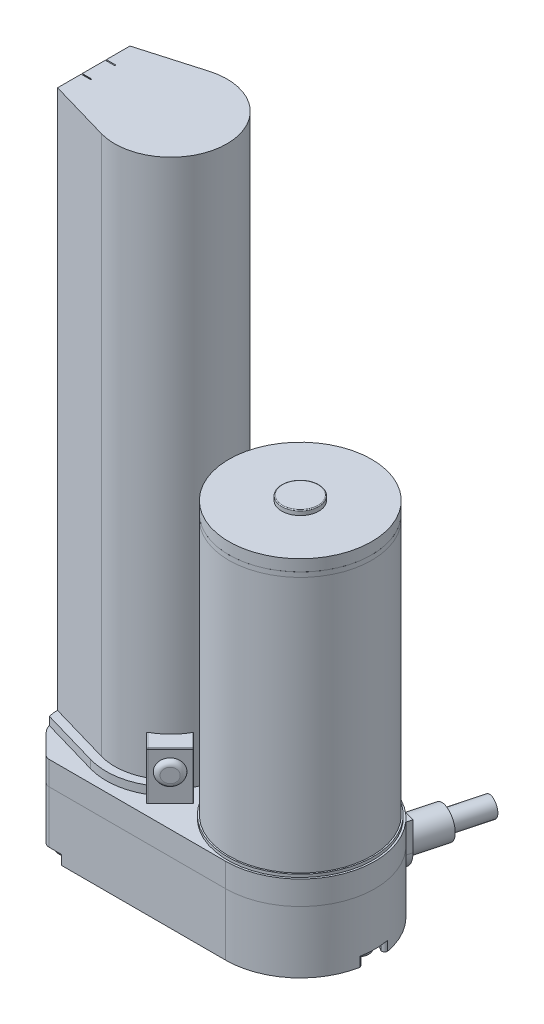
from build123d import *

# Parameters (mm, degrees)
BOSS_EXTRUDE1_DEPTH      = 6.35
SKETCH6_R                = 19.431
BOSS_EXTRUDE4_DEPTH      = 0.762
SKETCH7_R                = 19.05
BOSS_EXTRUDE5_DEPTH      = 68.326
FILLET6_R                = 5.08
FILLET7_R                = 1.905
BOSS_EXTRUDE15_DEPTH     = 6.35
SKETCH24_R               = 4.064
BOSS_EXTRUDE16_DEPTH     = 10.16
SKETCH25_R               = 2.54
BOSS_EXTRUDE17_DEPTH     = 10.16
BOSS_EXTRUDE19_DEPTH     = 16.51
FILLET13_R               = 1.905
FILLET14_R               = 5.08
BOSS_EXTRUDE20_DEPTH     = 18.796
CHAMFER1_SIZE            = 2.54
FILLET15_R               = 2.54
CHAMFER2_SIZE            = 0.762
SKETCH27_R               = 3.175
CUT_EXTRUDE3_DEPTH       = 19.05
SKETCH28_R               = 19.05
BOSS_EXTRUDE22_DEPTH     = 1.27
SKETCH29_R               = 19.05
BOSS_EXTRUDE24_DEPTH     = 3.048
BOSS_EXTRUDE25_START     = 4.318
SKETCH8_R                = 4.953
BOSS_EXTRUDE25_DEPTH     = 1.27
FILLET16_R               = 0.2286
BOSS_EXTRUDE26_DEPTH     = 152.781
BOSS_EXTRUDE27_DEPTH     = 8.89
SKETCH33_R               = 9.906
BOSS_EXTRUDE28_DEPTH     = 21.336
BOSS_EXTRUDE30_DEPTH     = 2.159
BOSS_EXTRUDE31_DEPTH     = 2.159
BOSS_EXTRUDE33_DEPTH     = 12.7
BOSS_EXTRUDE33_2_DEPTH   = 12.7
FILLET17_R               = 0.2286
FILLET18_R               = 0.2286
SKETCH43_R               = 3.175
BOSS_EXTRUDE34_DEPTH     = 1.27
FILLET19_R               = 1.27
SKETCH44_R               = 3.175
BOSS_EXTRUDE35_DEPTH     = 1.27
FILLET20_R               = 1.27
CUT_EXTRUDE5_START       = -2.54
CUT_EXTRUDE5_DEPTH       = 2.54
CUT_EXTRUDE6_START       = -2.54
CUT_EXTRUDE6_DEPTH       = 2.54
SKETCH47_R               = 2.54
BOSS_EXTRUDE36_DEPTH     = 2.54
BOSS_EXTRUDE36_2_DEPTH   = 2.54
BOSS_EXTRUDE36_3_DEPTH   = 2.54
FILLET22_R               = 1.524
FILLET23_R               = 1.524
SKETCH48_R               = 3.81
BOSS_EXTRUDE37_DEPTH     = 1.524
FILLET24_R               = 1.524
FILLET25_R               = 1.524
SKETCH49_R               = 3.81
CUT_EXTRUDE7_DEPTH       = 2.54
SKETCH50_R               = 3.556
BOSS_EXTRUDE39_DEPTH     = 2.54
CUT_EXTRUDE11_DEPTH      = 210.651074554
CUT_EXTRUDE11_DEPTH_BACK = 210.651074554
SKETCH52_R               = 3.175
SKETCH53_W               = 89.132477826
SKETCH53_H               = 21.730821801
CUT_EXTRUDE12_DEPTH      = 104.394
SKETCH54_W               = 24.892281138
SKETCH54_H               = 21.336
CUT_EXTRUDE13_DEPTH      = 104.394
SKETCH55_W               = 78.405339805
SKETCH55_H               = 17.293725945
CUT_EXTRUDE14_DEPTH      = 104.394


with BuildPart() as part:
    # Sketch1 → Boss-Extrude1 (new body)
    with BuildSketch(Plane(origin=(0, 0, 0), x_dir=(1, 0, 0), z_dir=(0, 1, 0))):
        with BuildLine():
            Line((0, 32.639), (7.239, 39.878))
            Line((7.239, 39.878), (55.118, 39.878))
            ThreePointArc((55.118, 39.878), (75.057, 19.939), (55.118, 0))
            Line((55.118, 0), (7.239, 0))
            Line((7.239, 0), (0, 7.239))
            Line((0, 7.239), (0, 32.639))
        make_face()
    extrude(amount=BOSS_EXTRUDE1_DEPTH)

    # Fillet6
    fillet6_edges = [part.edges().sort_by_distance(p)[0] for p in [
        (0, 3.175, -7.239),
        (0, 3.175, -32.639),
    ]]
    fillet(fillet6_edges, radius=FILLET6_R)

    # Fillet7
    fillet7_edges = [part.edges().sort_by_distance(p)[0] for p in [
        (7.239, 3.175, 0),
        (7.239, 3.175, -39.878),
    ]]
    fillet(fillet7_edges, radius=FILLET7_R)


with BuildPart() as body_2:
    # Sketch6 → Boss-Extrude4 (new body)
    with BuildSketch(Plane(origin=(0, 6.35, 0), x_dir=(1, 0, 0), z_dir=(0, 1, 0))):
        with Locations(Location((55.118, 19.939, 0), (0, 0, 90))):
            Circle(SKETCH6_R)
    extrude(amount=BOSS_EXTRUDE4_DEPTH)


with BuildPart() as body_3:
    # Sketch7 → Boss-Extrude5 (new body)
    with BuildSketch(Plane(origin=(0, 7.112, 0), x_dir=(1, 0, 0), z_dir=(0, 1, 0))):
        with Locations(Location((55.118, 19.939, 0), (0, 0, 270))):
            Circle(SKETCH7_R)
    extrude(amount=BOSS_EXTRUDE5_DEPTH)


with BuildPart() as body_4:
    # Sketch23 → Boss-Extrude15 (new body)
    with BuildSketch(Plane(origin=(12.522748088, 0, -46.735532116), x_dir=(0, -1, 0), z_dir=(0.25881904510252135, 0, -0.9659258262890681))):
        with BuildLine():
            Line((-2.032, -53.883866243), (5.588, -53.883866243))
            ThreePointArc((5.588, -53.883866243), (11.303, -48.168866243), (5.588, -42.453866243))
            Line((5.588, -42.453866243), (-2.032, -42.453866243))
            Line((-2.032, -42.453866243), (-2.032, -53.883866243))
        make_face()
    extrude(amount=BOSS_EXTRUDE15_DEPTH)

    # Sketch24 → Boss-Extrude16 (add)
    with BuildSketch(Plane(origin=(14.166249025, 0, -52.869161113), x_dir=(-0.9659258262890682, 0, -0.25881904510252135), z_dir=(0.2588190451025213, 0, -0.9659258262890681))):
        with Locations((-48.168866243, -5.588)):
            Circle(SKETCH24_R)
    extrude(amount=BOSS_EXTRUDE16_DEPTH)

    # Sketch25 → Boss-Extrude17 (add)
    with BuildSketch(Plane(origin=(16.795850523, 0, -62.682967508), x_dir=(-0.9659258262890681, 0, -0.25881904510252135), z_dir=(0.25881904510252135, 0, -0.9659258262890681))):
        with Locations((-48.168866243, -5.588)):
            Circle(SKETCH25_R)
    extrude(amount=BOSS_EXTRUDE17_DEPTH)


with BuildPart() as body_5:
    # Sketch1<3> → Boss-Extrude19 (new body)
    with BuildSketch(Plane(origin=(0, 0, 0), x_dir=(1, 0, 0), z_dir=(0, 1, 0))):
        with BuildLine():
            Line((0, 32.639), (7.239, 39.878))
            Line((7.239, 39.878), (55.118, 39.878))
            ThreePointArc((55.118, 39.878), (75.057, 19.939), (55.118, 0))
            Line((55.118, 0), (7.239, 0))
            Line((7.239, 0), (0, 7.239))
            Line((0, 7.239), (0, 32.639))
        make_face()
    extrude(amount=-BOSS_EXTRUDE19_DEPTH)

    # Fillet13
    fillet13_edges = [body_5.edges().sort_by_distance(p)[0] for p in [
        (7.239, -8.255, 0),
        (7.239, -8.255, -39.878),
    ]]
    fillet(fillet13_edges, radius=FILLET13_R)

    # Fillet14
    fillet14_edges = [body_5.edges().sort_by_distance(p)[0] for p in [
        (0, -8.255, -7.239),
        (0, -8.255, -32.639),
    ]]
    fillet(fillet14_edges, radius=FILLET14_R)

    # Sketch45 → Cut-Extrude5 (cut)
    with BuildSketch(Plane.XZ.offset(16.51).offset(CUT_EXTRUDE5_START)):
        with BuildLine():
            ThreePointArc((5.044290367, -35.978344089), (4.718699387, -36.549691761), (4.084467985, -36.723467985))
            Line((4.084467985, -36.723467985), (6.681038418, -39.320038418))
            ThreePointArc((6.681038418, -39.320038418), (7.299064898, -39.732990509), (8.028076836, -39.878))
            Line((8.028076836, -39.878), (11.393838428, -39.878))
            ThreePointArc((11.393838428, -39.878), (11.138454644, -39.419455597), (11.282110896, -38.914632134))
            ThreePointArc((11.282110896, -38.914632134), (10.476958507, -32.531164357), (5.044290367, -35.978344089))
        make_face()
        with BuildLine():
            ThreePointArc((11.282110896, -0.963367866), (11.138454644, -0.458544403), (11.393838428, 0))
            Line((11.393838428, 0), (8.028076836, 0))
            ThreePointArc((8.028076836, 0), (7.299064898, -0.145009491), (6.681038418, -0.557961582))
            Line((6.681038418, -0.557961582), (4.084467985, -3.154532015))
            ThreePointArc((4.084467985, -3.154532015), (4.718699387, -3.328308239), (5.044290367, -3.899655911))
            ThreePointArc((5.044290367, -3.899655911), (10.476958507, -7.346835643), (11.282110896, -0.963367866))
        make_face()
    extrude(amount=CUT_EXTRUDE5_DEPTH, mode=Mode.SUBTRACT)

    # Sketch45<3> → Cut-Extrude6 (cut)
    with BuildSketch(Plane.XZ.offset(16.51).offset(CUT_EXTRUDE6_START)):
        with BuildLine():
            Line((4.084467985, -36.723467985), (6.681038418, -39.320038418))
            ThreePointArc((6.681038418, -39.320038418), (7.299064898, -39.732990509), (8.028076836, -39.878))
            Line((8.028076836, -39.878), (11.393838428, -39.878))
            ThreePointArc((11.393838428, -39.878), (11.138454644, -39.419455597), (11.282110896, -38.914632134))
            ThreePointArc((11.282110896, -38.914632134), (10.476958507, -32.531164357), (5.044290367, -35.978344089))
            ThreePointArc((5.044290367, -35.978344089), (4.718699387, -36.549691761), (4.084467985, -36.723467985))
        make_face()
        with BuildLine():
            Line((11.393838428, 0), (8.028076836, 0))
            ThreePointArc((8.028076836, 0), (7.299064898, -0.145009491), (6.681038418, -0.557961582))
            Line((6.681038418, -0.557961582), (4.084467985, -3.154532015))
            ThreePointArc((4.084467985, -3.154532015), (4.718699387, -3.328308239), (5.044290367, -3.899655911))
            ThreePointArc((5.044290367, -3.899655911), (10.476958507, -7.346835643), (11.282110896, -0.963367866))
            ThreePointArc((11.282110896, -0.963367866), (11.138454644, -0.458544403), (11.393838428, 0))
        make_face()
        with BuildLine():
            ThreePointArc((73.662109712, -16.992248385), (67.437, -19.939), (73.662109712, -22.885751615))
            ThreePointArc((73.662109712, -22.885751615), (74.341584064, -23.041280193), (74.712069674, -23.631716426))
            ThreePointArc((74.712069674, -23.631716426), (75.057, -19.939), (74.712069674, -16.246283574))
            ThreePointArc((74.712069674, -16.246283574), (74.341584064, -16.836719807), (73.662109712, -16.992248385))
        make_face()
    extrude(amount=CUT_EXTRUDE6_DEPTH, mode=Mode.SUBTRACT)


with BuildPart() as body_6:
    # Sketch26 → Boss-Extrude20 (new body)
    with BuildSketch(Plane(origin=(0, -16.51, 0), x_dir=(-1, 0, 0), z_dir=(0, -1, 0))):
        Polygon((-20.574, 28.829), (-11.684, 28.829), (-11.684, 11.049), (-29.464, 11.049), (-29.464, 28.829), align=None)
    extrude(amount=BOSS_EXTRUDE20_DEPTH)

    # Chamfer1
    chamfer1_edges = [body_6.edges().sort_by_distance(p)[0] for p in [
        (11.684, -25.908, -11.049),
        (29.464, -25.908, -11.049),
        (29.464, -25.908, -28.829),
        (11.684, -25.908, -28.829),
    ]]
    chamfer(chamfer1_edges, length=CHAMFER1_SIZE)

    # Fillet15
    fillet15_edges = [body_6.edges().sort_by_distance(p)[0] for p in [
        (29.464, -25.908, -13.589),
        (29.464, -25.908, -26.289),
        (14.224, -25.908, -28.829),
        (26.924, -25.908, -28.829),
        (14.224, -25.908, -11.049),
        (26.924, -25.908, -11.049),
        (11.684, -25.908, -26.289),
        (11.684, -25.908, -13.589),
    ]]
    fillet(fillet15_edges, radius=FILLET15_R)

    # Chamfer2
    chamfer2_edges = [body_6.edges().sort_by_distance(p)[0] for p in [
        (11.684, -35.306, -19.939),
        (12.954, -35.306, -12.319),
        (20.574, -35.306, -28.829),
        (28.194, -35.306, -27.559),
        (29.464, -35.306, -19.939),
        (28.194, -35.306, -12.319),
        (20.574, -35.306, -11.049),
        (12.954, -35.306, -27.559),
        (14.30408653, -35.306, -28.635654013),
        (11.877345987, -35.306, -26.20891347),
        (26.84391347, -35.306, -28.635654013),
        (29.270654013, -35.306, -26.20891347),
        (29.270654013, -35.306, -13.66908653),
        (26.84391347, -35.306, -11.242345987),
        (14.30408653, -35.306, -11.242345987),
        (11.877345987, -35.306, -13.66908653),
    ]]
    chamfer(chamfer2_edges, length=CHAMFER2_SIZE)

    # Sketch27 → Cut-Extrude3 (cut)
    with BuildSketch(Plane.XY.offset(-11.049)):
        with Locations((20.574, -26.67)):
            Circle(SKETCH27_R)
    extrude(amount=-CUT_EXTRUDE3_DEPTH, mode=Mode.SUBTRACT)

    # Sketch53 → Cut-Extrude12 (cut)
    with BuildSketch(Plane.XY):
        with Locations((44.566238913, -27.375410901)):
            Rectangle(SKETCH53_W, SKETCH53_H)
    extrude(amount=-CUT_EXTRUDE12_DEPTH, mode=Mode.SUBTRACT)


with BuildPart() as body_7:
    # Sketch28 → Boss-Extrude22 (new body)
    with BuildSketch(Plane(origin=(0, 75.438, 0), x_dir=(1, 0, 0), z_dir=(0, 1, 0))):
        with Locations(Location((55.118, 19.939, 0), (0, 0, 270))):
            Circle(SKETCH28_R)
    extrude(amount=BOSS_EXTRUDE22_DEPTH)


with BuildPart() as body_8:
    # Sketch29 → Boss-Extrude24 (new body)
    with BuildSketch(Plane(origin=(0, 76.708, 0), x_dir=(1, 0, 0), z_dir=(0, 1, 0))):
        with Locations(Location((55.118, 19.939, 0), (0, 0, 90))):
            Circle(SKETCH29_R)
    extrude(amount=BOSS_EXTRUDE24_DEPTH)

    # Sketch8 → Boss-Extrude25 (add)
    with BuildSketch(Plane(origin=(0, 75.438, 0), x_dir=(1, 0, 0), z_dir=(0, 1, 0)).offset(BOSS_EXTRUDE25_START)):
        with Locations(Location((55.118, 19.939, 0), (0, 0, 270))):
            Circle(SKETCH8_R)
    extrude(amount=BOSS_EXTRUDE25_DEPTH)

    # Fillet16
    fillet16_edges = [body_8.edges().sort_by_distance(p)[0] for p in [
        (55.118, 81.026, -24.892),
    ]]
    fillet(fillet16_edges, radius=FILLET16_R)


with BuildPart() as body_9:
    # Sketch15 → Boss-Extrude26 (new body)
    with BuildSketch(Plane(origin=(0, 6.35, 0), x_dir=(1, 0, 0), z_dir=(0, 1, 0))):
        with BuildLine():
            Line((0, 19.939), (0, 10.286870396))
            Line((0, 10.286870396), (16.411980417, 5.54225678))
            ThreePointArc((16.411980417, 5.54225678), (35.560281138, 19.939054609), (16.411875495, 34.335712887))
            Line((16.411875495, 34.335712887), (0, 29.591))
            Line((0, 29.591), (0, 19.939))
        make_face()
    extrude(amount=BOSS_EXTRUDE26_DEPTH)

    # Sketch48 → Boss-Extrude37 (add)
    with BuildSketch(Plane.ZY):
        with Locations(Location((-19.939, 12.7, 0), (0, 0, 180))):
            Circle(SKETCH48_R)
    extrude(amount=BOSS_EXTRUDE37_DEPTH)

    # Fillet24
    fillet24_edges = [body_9.edges().sort_by_distance(p)[0] for p in [
        (-1.524, 12.7, -16.129),
    ]]
    fillet(fillet24_edges, radius=FILLET24_R - 0.0001)  # a hair under: the kernel refuses the full size

    # Sketch49 → Cut-Extrude7 (cut)
    with BuildSketch(Plane.ZY):
        with Locations((-19.938935198, 154.178)):
            Circle(SKETCH49_R)
    extrude(amount=-CUT_EXTRUDE7_DEPTH, mode=Mode.SUBTRACT)

    # Sketch50 → Boss-Extrude39 (add)
    with BuildSketch(Plane.ZY.offset(-2.54)):
        with Locations((-19.938935198, 154.178)):
            Circle(SKETCH50_R)
    extrude(amount=BOSS_EXTRUDE39_DEPTH)


with BuildPart() as body_10:
    # Sketch32 → Boss-Extrude27 (new body)
    with BuildSketch(Plane(origin=(0, 159.131, 0), x_dir=(1, 0, 0), z_dir=(0, 1, 0))):
        with BuildLine():
            Line((0, 10.286870396), (0, 29.591))
            Line((0, 29.591), (16.411875495, 34.335712887))
            ThreePointArc((16.411875495, 34.335712887), (35.560281138, 19.939054609), (16.411980417, 5.54225678))
            Line((16.411980417, 5.54225678), (0, 10.286870396))
        make_face()
    extrude(amount=BOSS_EXTRUDE27_DEPTH)

    # Sketch33 → Boss-Extrude28 (add)
    with BuildSketch(Plane(origin=(0, 168.021, 0), x_dir=(1, 0, 0), z_dir=(0, 1, 0))):
        with Locations(Location((20.574, 19.939, 0), (0, 0, 270))):
            Circle(SKETCH33_R)
    extrude(amount=BOSS_EXTRUDE28_DEPTH)

    # Sketch52 → Cut-Extrude11 (cut, two sides: drawn at the far end of the back side and taken through both)
    with BuildSketch(Plane.XY.offset(-11.049).offset(-CUT_EXTRUDE11_DEPTH_BACK)):
        with Locations(Location((20.574, 179.832, 0), (0, 0, 89.99999999))):
            Circle(SKETCH52_R)
    extrude(amount=CUT_EXTRUDE11_DEPTH + CUT_EXTRUDE11_DEPTH_BACK, mode=Mode.SUBTRACT)

    # Sketch54 → Cut-Extrude13 (cut)
    with BuildSketch(Plane.XY):
        with Locations((23.114140569, 178.689)):
            Rectangle(SKETCH54_W, SKETCH54_H)
    extrude(amount=-CUT_EXTRUDE13_DEPTH, mode=Mode.SUBTRACT)


with BuildPart() as body_11:
    # Sketch41 → Boss-Extrude30 (new body)
    with BuildSketch(Plane(origin=(0, 6.35, 0), x_dir=(1, 0, 0), z_dir=(0, 1, 0))):
        with BuildLine():
            Line((0, 29.591), (16.411875495, 34.335712887))
            ThreePointArc((16.411875495, 34.335712887), (22.021175201, 34.855243035), (27.425990452, 33.267122493))
            Line((27.425990452, 33.267122493), (29.11221422, 34.953346261))
            ThreePointArc((29.11221422, 34.953346261), (22.604273469, 37.091541659), (15.776987058, 36.531780434))
            Line((15.776987058, 36.531780434), (0.2736806, 32.049737053))
            Line((0.2736806, 32.049737053), (0, 30.534795103))
            Line((0, 30.534795103), (0, 29.591))
        make_face()
    extrude(amount=BOSS_EXTRUDE30_DEPTH)


with BuildPart() as body_12:
    # Sketch41<11> → Boss-Extrude31 (new body)
    with BuildSketch(Plane(origin=(0, 6.35, 0), x_dir=(1, 0, 0), z_dir=(0, 1, 0))):
        with BuildLine():
            Line((16.411875495, 5.542157508), (0, 10.286870396))
            Line((0, 10.286870396), (0, 9.343204897))
            Line((0, 9.343204897), (0, 9.343075292))
            Line((0, 9.343075292), (0.2736806, 7.828133343))
            Line((0.2736806, 7.828133343), (15.776987058, 3.346089961))
            ThreePointArc((15.776987058, 3.346089961), (22.604273469, 2.786328737), (29.11221422, 4.924524135))
            Line((29.11221422, 4.924524135), (27.425990452, 6.610747903))
            ThreePointArc((27.425990452, 6.610747903), (22.021175201, 5.02262736), (16.411875495, 5.542157508))
        make_face()
    extrude(amount=BOSS_EXTRUDE31_DEPTH)


with BuildPart() as body_13:
    # Sketch41<12> → Boss-Extrude33 (new body)
    with BuildSketch(Plane(origin=(0, 6.35, 0), x_dir=(1, 0, 0), z_dir=(0, 1, 0))):
        with BuildLine():
            Line((29.11221422, 34.953346261), (27.425990452, 33.267122493))
            ThreePointArc((27.425990452, 33.267122493), (31.070982239, 30.634886416), (33.77116823, 27.039941701))
            Line((33.77116823, 27.039941701), (37.542875801, 30.811649272))
            Line((37.542875801, 30.811649272), (31.256696516, 37.097828557))
            Line((31.256696516, 37.097828557), (29.11221422, 34.953346261))
        make_face()
    extrude(amount=BOSS_EXTRUDE33_DEPTH)

    # Fillet17
    fillet17_edges = [body_13.edges().sort_by_distance(p)[0] for p in [
        (35.657022016, 19.05, -28.925795487),
        (34.399786159, 19.05, -33.954738915),
        (29.341343484, 19.05, -35.182475525),
        (31.256696516, 12.7, -37.097828557),
        (37.542875801, 12.7, -30.811649272),
    ]]
    fillet(fillet17_edges, radius=FILLET17_R)


with BuildPart() as body_14:
    # Sketch41<12> → Boss-Extrude33 2 (new body)
    with BuildSketch(Plane(origin=(0, 6.35, 0), x_dir=(1, 0, 0), z_dir=(0, 1, 0))):
        with BuildLine():
            Line((31.256696516, 2.780041839), (37.542875801, 9.066221123))
            Line((37.542875801, 9.066221123), (33.77116823, 12.837928694))
            ThreePointArc((33.77116823, 12.837928694), (31.070982239, 9.24298398), (27.425990452, 6.610747903))
            Line((27.425990452, 6.610747903), (29.11221422, 4.924524135))
            Line((29.11221422, 4.924524135), (31.256696516, 2.780041839))
        make_face()
    extrude(amount=BOSS_EXTRUDE33_2_DEPTH)

    # Fillet18
    fillet18_edges = [body_14.edges().sort_by_distance(p)[0] for p in [
        (34.399786159, 19.05, -5.923131481),
        (35.657022016, 19.05, -10.952074909),
        (29.341343484, 19.05, -4.695394871),
        (37.542875801, 12.7, -9.066221123),
        (31.256696516, 12.7, -2.780041839),
    ]]
    fillet(fillet18_edges, radius=FILLET18_R)


with BuildPart() as body_15:
    # Sketch43 → Boss-Extrude34 (new body)
    with BuildSketch(Plane(origin=(34.177262537, 0, -34.177262537), x_dir=(-0.7071067811865481, 0, -0.7071067811865469), z_dir=(0.7071067811865469, 0, -0.7071067811865481))):
        with Locations(Location((-0.314695924, 13.7414, 0), (0, 0, 180))):
            Circle(SKETCH43_R)
    extrude(amount=BOSS_EXTRUDE34_DEPTH)

    # Fillet19
    fillet19_edges = [body_15.edges().sort_by_distance(p)[0] for p in [
        (33.052747741, 13.7414, -37.097828557),
    ]]
    fillet(fillet19_edges, radius=FILLET19_R - 0.0001)  # a hair under: the kernel refuses the full size


with BuildPart() as body_16:
    # Sketch44 → Boss-Extrude35 (new body)
    with BuildSketch(Plane(origin=(14.238327339, 0, 14.238327339), x_dir=(0.7071067811865481, 0, -0.7071067811865469), z_dir=(0.7071067811865469, 0, 0.7071067811865481))):
        with Locations(Location((28.5126085, 13.7414, 0), (0, 0, 180))):
            Circle(SKETCH44_R)
    extrude(amount=BOSS_EXTRUDE35_DEPTH)

    # Fillet20
    fillet20_edges = [body_16.edges().sort_by_distance(p)[0] for p in [
        (37.542875801, 13.7414, -7.270169899),
    ]]
    fillet(fillet20_edges, radius=FILLET20_R - 0.0001)  # a hair under: the kernel refuses the full size


with BuildPart() as body_17:
    # Sketch47 → Boss-Extrude36 (new body)
    with BuildSketch(Plane(origin=(0, -13.97, 0), x_dir=(-1, 0, 0), z_dir=(0, -1, 0))):
        with Locations(Location((-8.854290367, 35.978344089, 0), (0, 0, 90))):
            Circle(SKETCH47_R)
    extrude(amount=BOSS_EXTRUDE36_DEPTH)

    # Fillet22
    fillet22_edges = [body_17.edges().sort_by_distance(p)[0] for p in [
        (8.854290367, -16.51, -33.438344089),
    ]]
    fillet(fillet22_edges, radius=FILLET22_R)


with BuildPart() as body_18:
    # Sketch47 → Boss-Extrude36 2 (new body)
    with BuildSketch(Plane(origin=(0, -13.97, 0), x_dir=(-1, 0, 0), z_dir=(0, -1, 0))):
        with Locations(Location((-8.854290367, 3.899655911, 0), (0, 0, 90))):
            Circle(SKETCH47_R)
    extrude(amount=BOSS_EXTRUDE36_2_DEPTH)

    # Fillet23
    fillet23_edges = [body_18.edges().sort_by_distance(p)[0] for p in [
        (8.854290367, -16.51, -1.359655911),
    ]]
    fillet(fillet23_edges, radius=FILLET23_R)


with BuildPart() as body_19:
    # Sketch47 → Boss-Extrude36 3 (new body)
    with BuildSketch(Plane(origin=(0, -13.97, 0), x_dir=(-1, 0, 0), z_dir=(0, -1, 0))):
        with Locations(Location((-71.247, 19.939, 0), (0, 0, 90))):
            Circle(SKETCH47_R)
    extrude(amount=BOSS_EXTRUDE36_3_DEPTH)

    # Fillet25
    fillet25_edges = [body_19.edges().sort_by_distance(p)[0] for p in [
        (71.247, -16.51, -17.399),
    ]]
    fillet(fillet25_edges, radius=FILLET25_R)


with BuildPart() as cut_extrude14_tool:
    # Sketch55 → Cut-Extrude14 (new body)
    with BuildSketch(Plane.XY):
        with Locations((39.202669903, 161.046862973)):
            Rectangle(SKETCH55_W, SKETCH55_H)
    extrude(amount=-CUT_EXTRUDE14_DEPTH)


with BuildPart() as body_9_1:
    add(body_9.part)

    # Cut-Extrude14: cut by cut_extrude14_tool
    add(cut_extrude14_tool.part, mode=Mode.SUBTRACT)


with BuildPart() as body_10_1:
    add(body_10.part)

    # Cut-Extrude14: cut by cut_extrude14_tool
    add(cut_extrude14_tool.part, mode=Mode.SUBTRACT)


solid = Compound([part.part, body_2.part, body_3.part, body_4.part, body_5.part, body_7.part, body_8.part, body_11.part, body_12.part, body_13.part, body_14.part, body_15.part, body_16.part, body_17.part, body_18.part, body_19.part, body_9_1.part])
